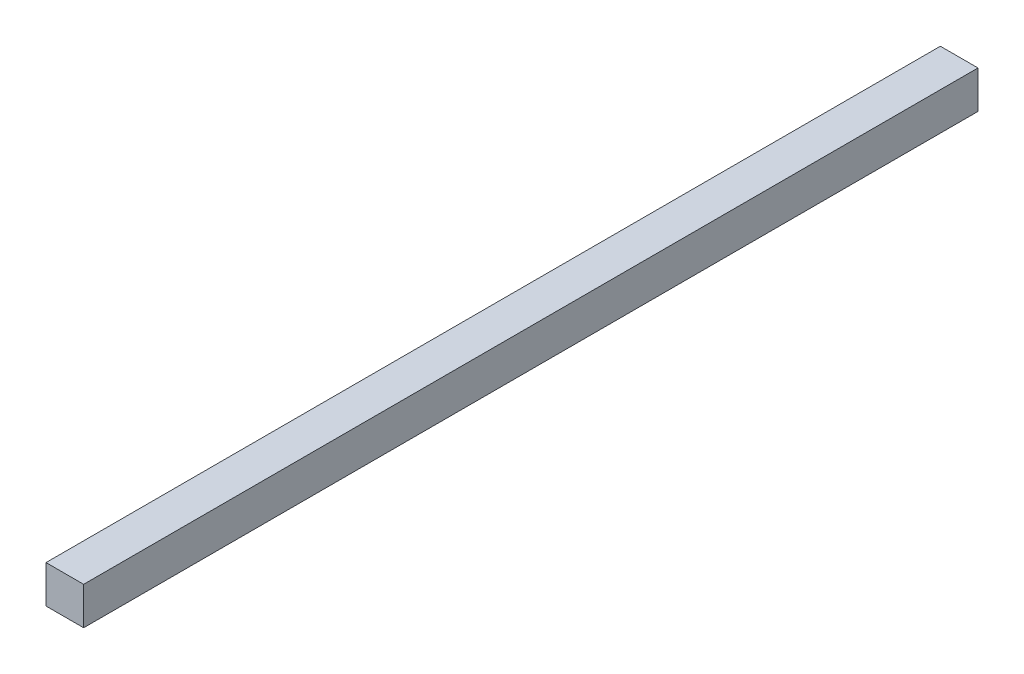
from build123d import *

# Parameters (mm, degrees)
SKETCH3_W           = 4
SKETCH3_H           = 4
BOSS_EXTRUDE1_DEPTH = 95


with BuildPart() as part:
    # Sketch3 → Boss-Extrude1 (new body)
    with BuildSketch(Plane.XY):
        Rectangle(SKETCH3_W, SKETCH3_H)
    extrude(amount=BOSS_EXTRUDE1_DEPTH)


solid = part.part
